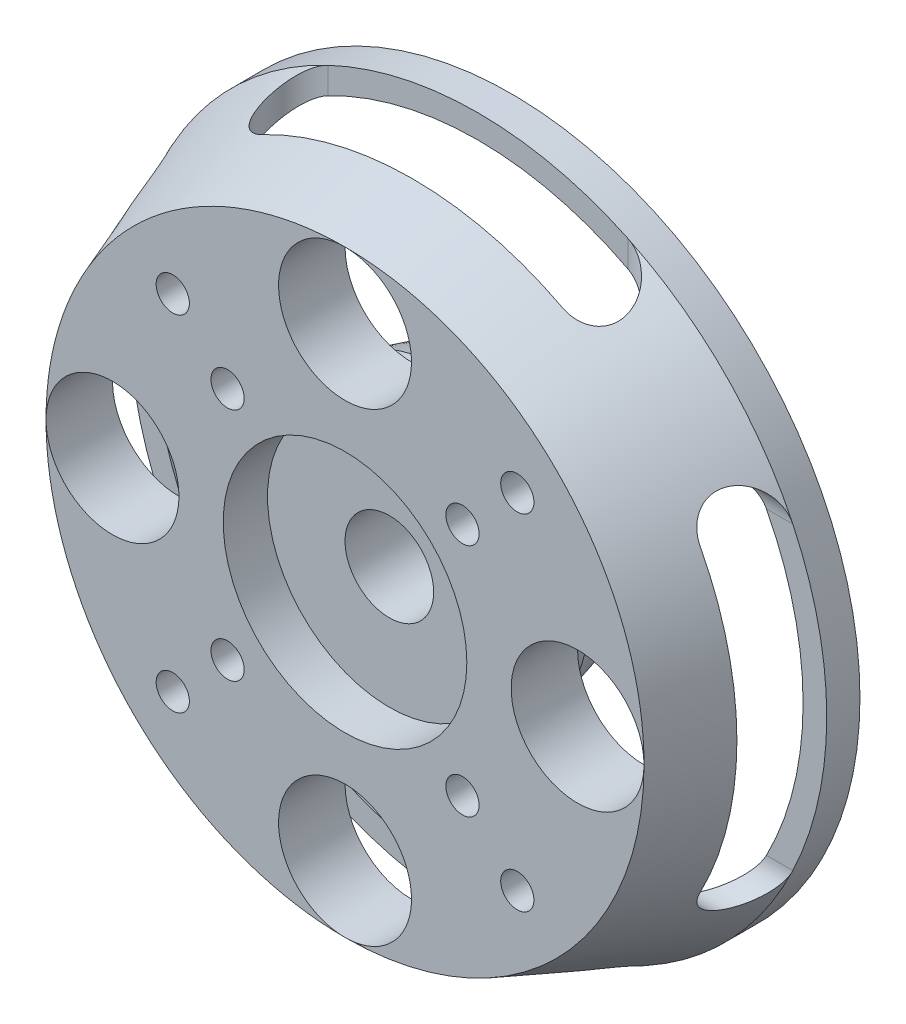
from build123d import *

# Parameters (mm, degrees)
CUT_EXTRUDE1_DEPTH = 10
CIRPATTERN1_COUNT  = 4
SKETCH3_R          = 6
SKETCH3_R_2        = 1.5
CUT_EXTRUDE2_DEPTH = 48.005318848


with BuildPart() as part:
    # Sketch1 → Revolve1 (revolve)
    with BuildSketch(Plane(origin=(0, 0, 0), x_dir=(1, 0, 0), z_dir=(0, 1, 0))):
        Polygon((29.5, 15), (29.5, 12.362669164), (27.113999064, 6), (13, 6), (13, 9), (11.392304845, 15), (4, 15), (4, 4), (11, 4), (11, 0), (27, 0), (31.5, 12), (31.5, 15), align=None)
    revolve(axis=Axis((0, 0, 76.888888889), (0, 0, -1)))

    # Sketch2 → Cut-Extrude1 (cut)
    with BuildSketch(Plane.ZY.offset(31.5)):
        with BuildLine():
            Line((-12, -13.55), (-12, 13.55))
            ThreePointArc((-12, 13.55), (-9.05, 16.5), (-6.1, 13.55))
            Line((-6.1, 13.55), (-6.1, -13.55))
            ThreePointArc((-6.1, -13.55), (-9.05, -16.5), (-12, -13.55))
        make_face()
    cut_extrude1 = extrude(amount=-CUT_EXTRUDE1_DEPTH, mode=Mode.SUBTRACT)

    # CirPattern1: Cut-Extrude1 ×4 about axis
    cirpattern1_axis = Axis((0, 0, -15.75), (0, 0, 1))
    for i in range(1, CIRPATTERN1_COUNT):
        add(cut_extrude1.rotate(cirpattern1_axis, i * 360 / CIRPATTERN1_COUNT), mode=Mode.SUBTRACT)

    # Sketch3 → Cut-Extrude2 (cut, through all)
    with BuildSketch(Plane.XY):
        with Locations((-21, 0)):
            Circle(SKETCH3_R)
        with Locations((0, 21)):
            Circle(SKETCH3_R)
        with Locations((21, 0)):
            Circle(SKETCH3_R)
        with Locations((0, -21)):
            Circle(SKETCH3_R)
        with Locations((-15.556349186, 15.556349186)):
            Circle(SKETCH3_R_2)
        with Locations((-10.606601718, 10.606601718)):
            Circle(SKETCH3_R_2)
        with Locations((10.606601718, 10.606601718)):
            Circle(SKETCH3_R_2)
        with Locations((15.556349186, 15.556349186)):
            Circle(SKETCH3_R_2)
        with Locations((10.606601718, -10.606601718)):
            Circle(SKETCH3_R_2)
        with Locations((15.556349186, -15.556349186)):
            Circle(SKETCH3_R_2)
        with Locations((-10.606601718, -10.606601718)):
            Circle(SKETCH3_R_2)
        with Locations((-15.556349186, -15.556349186)):
            Circle(SKETCH3_R_2)
    extrude(amount=-CUT_EXTRUDE2_DEPTH, mode=Mode.SUBTRACT)


solid = part.part
